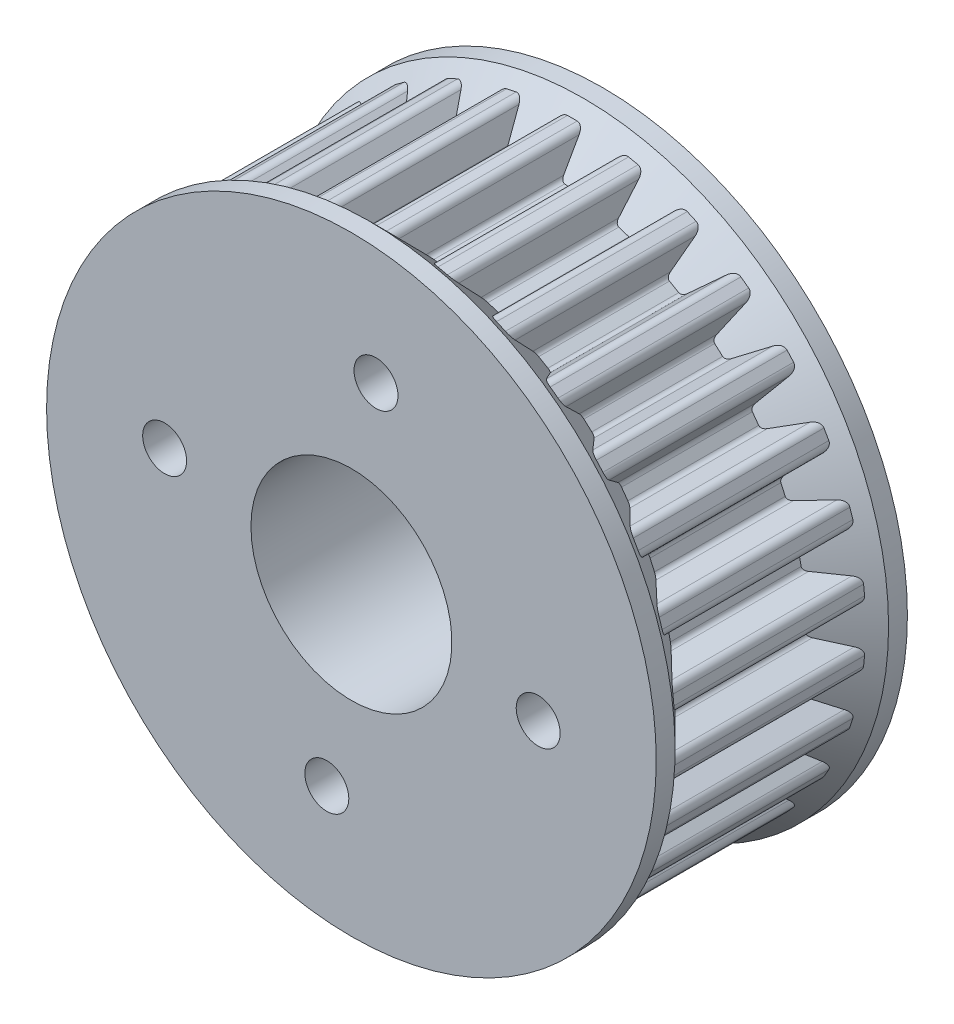
from build123d import *

# Parameters (mm, degrees)
BOSS_EXTRU_1_DEPTH      = 19
ESQUISSE2_R             = 1.75
ENL_V_MAT_EXTRU_1_DEPTH = 40.727364947
ESQUISSE4_R             = 9
ENL_V_MAT_EXTRU_2_DEPTH = 4
ESQUISSE5_R             = 8
ENL_V_MAT_EXTRU_3_DEPTH = 38.87167181
ESQUISSE6_R             = 3.75
ESQUISSE6_R_2           = 1.75
ENL_V_MAT_EXTRU_4_DEPTH = 4


with BuildPart() as part:
    # Esquisse1 → Boss.-Extru.1 (new body)
    with BuildSketch(Plane.XY):
        with BuildLine():
            Line((0.38576761, 23.359679617), (0, 23.359679617))
            Line((0, 23.359679617), (-0.38576761, 23.359679617))
            ThreePointArc((-0.38576761, 23.359679617), (-0.751024468, 23.235691621), (-0.965323106, 22.914971044))
            Line((-0.965323106, 22.914971044), (-1.42516663, 21.198811651))
            ThreePointArc((-1.42516663, 21.198811651), (-1.551757741, 20.998176883), (-1.769725575, 20.904530511))
            Line((-1.769725575, 20.904530511), (-2.615243459, 20.815663))
            ThreePointArc((-2.615243459, 20.815663), (-2.847918349, 20.861944913), (-3.013457454, 21.031875558))
            Line((-3.013457454, 21.031875558), (-3.820061895, 22.614925907))
            ThreePointArc((-3.820061895, 22.614925907), (-4.096359151, 22.884082778), (-4.479412824, 22.929420168))
            Line((-4.479412824, 22.929420168), (-4.856750486, 22.849214571))
            Line((-4.856750486, 22.849214571), (-5.234088149, 22.769008975))
            ThreePointArc((-5.234088149, 22.769008975), (-5.565584714, 22.571789244), (-5.708518855, 22.213521989))
            Line((-5.708518855, 22.213521989), (-5.801504093, 20.439257951))
            ThreePointArc((-5.801504093, 20.439257951), (-5.883614571, 20.216687762), (-6.077349109, 20.079769727))
            Line((-6.077349109, 20.079769727), (-6.885913805, 19.817051132))
            ThreePointArc((-6.885913805, 19.817051132), (-7.12312674, 19.813945844), (-7.320378987, 19.945745582))
            Line((-7.320378987, 19.945745582), (-8.43849186, 21.326499989))
            ThreePointArc((-8.43849186, 21.326499989), (-8.764712219, 21.532329707), (-9.148821423, 21.497035029))
            Line((-9.148821423, 21.497035029), (-9.501237671, 21.340129206))
            Line((-9.501237671, 21.340129206), (-9.853653919, 21.183223383))
            ThreePointArc((-9.853653919, 21.183223383), (-10.136902201, 20.921391365), (-10.202224937, 20.54123543))
            Line((-10.202224937, 20.54123543), (-9.924287989, 18.7864106))
            ThreePointArc((-9.924287989, 18.7864106), (-9.958329211, 18.551632375), (-10.119363325, 18.377426653))
            Line((-10.119363325, 18.377426653), (-10.855636675, 17.952339036))
            ThreePointArc((-10.855636675, 17.952339036), (-11.087020313, 17.899982264), (-11.307364831, 17.987890813))
            Line((-11.307364831, 17.987890813), (-12.688119239, 19.106003686))
            ThreePointArc((-12.688119239, 19.106003686), (-13.050005304, 19.239510504), (-13.418382625, 19.125126306))
            Line((-13.418382625, 19.125126306), (-13.730475177, 18.898377793))
            Line((-13.730475177, 18.898377793), (-14.04256773, 18.671629281))
            ThreePointArc((-14.04256773, 18.671629281), (-14.265188419, 18.356628291), (-14.250044834, 17.971198315))
            Line((-14.250044834, 17.971198315), (-13.613332878, 16.312506959))
            ThreePointArc((-13.613332878, 16.312506959), (-13.59781708, 16.075781634), (-13.719112806, 15.871901849))
            Line((-13.719112806, 15.871901849), (-14.350916131, 15.30302358))
            ThreePointArc((-14.350916131, 15.30302358), (-14.566357897, 15.203703565), (-14.800164573, 15.2438789))
            Line((-14.800164573, 15.2438789), (-16.383214922, 16.050483341))
            ThreePointArc((-16.383214922, 16.050483341), (-16.764950537, 16.105832371), (-17.101496117, 15.91735779))
            Line((-17.101496117, 15.91735779), (-17.359625032, 15.630676587))
            Line((-17.359625032, 15.630676587), (-17.617753947, 15.343995383))
            ThreePointArc((-17.617753947, 15.343995383), (-17.770017452, 14.989592477), (-17.675069393, 14.615733598))
            Line((-17.675069393, 14.615733598), (-16.707409796, 13.125668488))
            ThreePointArc((-16.707409796, 13.125668488), (-16.643015093, 12.897342094), (-16.719271225, 12.672698773))
            Line((-16.719271225, 12.672698773), (-17.218991689, 11.984892561))
            ThreePointArc((-17.218991689, 11.984892561), (-17.409075743, 11.842950065), (-17.646126105, 11.833636331))
            Line((-17.646126105, 11.833636331), (-19.362285498, 12.293479855))
            ThreePointArc((-19.362285498, 12.293479855), (-19.747186985, 12.268252079), (-20.037192168, 12.013924359))
            Line((-20.037192168, 12.013924359), (-20.230075973, 11.679839809))
            Line((-20.230075973, 11.679839809), (-20.422959778, 11.345755258))
            ThreePointArc((-20.422959778, 11.345755258), (-20.498211452, 10.967439543), (-20.327608604, 10.621491189))
            Line((-20.327608604, 10.621491189), (-19.071292734, 9.365175319))
            ThreePointArc((-19.071292734, 9.365175319), (-18.960833484, 9.155226817), (-18.988717264, 8.91963795))
            Line((-18.988717264, 8.91963795), (-19.334514684, 8.142964227))
            ThreePointArc((-19.334514684, 8.142964227), (-19.490933441, 7.964602819), (-19.72086725, 7.906207071))
            Line((-19.72086725, 7.906207071), (-21.495131287, 7.999192309))
            ThreePointArc((-21.495131287, 7.999192309), (-21.866376603, 7.894490301), (-22.097166771, 7.585424784))
            Line((-22.097166771, 7.585424784), (-22.216375519, 7.218537985))
            Line((-22.216375519, 7.218537985), (-22.335584266, 6.851651185))
            ThreePointArc((-22.335584266, 6.851651185), (-22.330535251, 6.465956873), (-22.091733777, 6.163038648))
            Line((-22.091733777, 6.163038648), (-20.601668667, 5.195379051))
            ThreePointArc((-20.601668667, 5.195379051), (-20.449972468, 5.012984196), (-20.42826524, 4.776746147))
            Line((-20.42826524, 4.776746147), (-20.60502661, 3.945149283))
            ThreePointArc((-20.60502661, 3.945149283), (-20.720943821, 3.738164211), (-20.933711865, 3.633238623))
            Line((-20.933711865, 3.633238623), (-22.688536694, 3.355301674))
            ThreePointArc((-22.688536694, 3.355301674), (-23.029900638, 3.175701415), (-23.191389153, 2.825405748))
            Line((-23.191389153, 2.825405748), (-23.231712848, 2.441751413))
            Line((-23.231712848, 2.441751413), (-23.272036544, 2.058097078))
            ThreePointArc((-23.272036544, 2.058097078), (-23.186907505, 1.681880861), (-22.890344176, 1.435231744))
            Line((-22.890344176, 1.435231744), (-21.23165282, 0.798519787))
            ThreePointArc((-21.23165282, 0.798519787), (-21.045349525, 0.651650111), (-20.975, 0.425087617))
            Line((-20.975, 0.425087617), (-20.975, -0.425087617))
            ThreePointArc((-20.975, -0.425087617), (-21.045349525, -0.651650111), (-21.23165282, -0.798519787))
            Line((-21.23165282, -0.798519787), (-22.890344176, -1.435231744))
            ThreePointArc((-22.890344176, -1.435231744), (-23.186907505, -1.681880861), (-23.272036544, -2.058097078))
            Line((-23.272036544, -2.058097078), (-23.231712848, -2.441751413))
            Line((-23.231712848, -2.441751413), (-23.191389153, -2.825405748))
            ThreePointArc((-23.191389153, -2.825405748), (-23.029900638, -3.175701415), (-22.688536694, -3.355301674))
            Line((-22.688536694, -3.355301674), (-20.933711865, -3.633238623))
            ThreePointArc((-20.933711865, -3.633238623), (-20.720943821, -3.738164211), (-20.60502661, -3.945149283))
            Line((-20.60502661, -3.945149283), (-20.42826524, -4.776746147))
            ThreePointArc((-20.42826524, -4.776746147), (-20.449972468, -5.012984196), (-20.601668667, -5.195379051))
            Line((-20.601668667, -5.195379051), (-22.091733777, -6.163038648))
            ThreePointArc((-22.091733777, -6.163038648), (-22.330535251, -6.465956873), (-22.335584266, -6.851651185))
            Line((-22.335584266, -6.851651185), (-22.216375519, -7.218537985))
            Line((-22.216375519, -7.218537985), (-22.097166771, -7.585424784))
            ThreePointArc((-22.097166771, -7.585424784), (-21.866376603, -7.894490301), (-21.495131287, -7.999192309))
            Line((-21.495131287, -7.999192309), (-19.72086725, -7.906207071))
            ThreePointArc((-19.72086725, -7.906207071), (-19.490933441, -7.964602819), (-19.334514684, -8.142964227))
            Line((-19.334514684, -8.142964227), (-18.988717264, -8.91963795))
            ThreePointArc((-18.988717264, -8.91963795), (-18.960833484, -9.155226817), (-19.071292734, -9.365175319))
            Line((-19.071292734, -9.365175319), (-20.327608604, -10.621491189))
            ThreePointArc((-20.327608604, -10.621491189), (-20.498211452, -10.967439543), (-20.422959778, -11.345755258))
            Line((-20.422959778, -11.345755258), (-20.230075973, -11.679839809))
            Line((-20.230075973, -11.679839809), (-20.037192168, -12.013924359))
            ThreePointArc((-20.037192168, -12.013924359), (-19.747186985, -12.268252079), (-19.362285498, -12.293479855))
            Line((-19.362285498, -12.293479855), (-17.646126105, -11.833636331))
            ThreePointArc((-17.646126105, -11.833636331), (-17.409075743, -11.842950065), (-17.218991689, -11.984892561))
            Line((-17.218991689, -11.984892561), (-16.719271225, -12.672698773))
            ThreePointArc((-16.719271225, -12.672698773), (-16.643015093, -12.897342094), (-16.707409796, -13.125668488))
            Line((-16.707409796, -13.125668488), (-17.675069393, -14.615733598))
            ThreePointArc((-17.675069393, -14.615733598), (-17.770017452, -14.989592477), (-17.617753947, -15.343995383))
            Line((-17.617753947, -15.343995383), (-17.359625032, -15.630676587))
            Line((-17.359625032, -15.630676587), (-17.101496117, -15.91735779))
            ThreePointArc((-17.101496117, -15.91735779), (-16.764950537, -16.105832371), (-16.383214922, -16.050483341))
            Line((-16.383214922, -16.050483341), (-14.800164573, -15.2438789))
            ThreePointArc((-14.800164573, -15.2438789), (-14.566357897, -15.203703565), (-14.350916131, -15.30302358))
            Line((-14.350916131, -15.30302358), (-13.719112806, -15.871901849))
            ThreePointArc((-13.719112806, -15.871901849), (-13.59781708, -16.075781634), (-13.613332878, -16.312506959))
            Line((-13.613332878, -16.312506959), (-14.250044834, -17.971198315))
            ThreePointArc((-14.250044834, -17.971198315), (-14.265188419, -18.356628291), (-14.04256773, -18.671629281))
            Line((-14.04256773, -18.671629281), (-13.730475177, -18.898377793))
            Line((-13.730475177, -18.898377793), (-13.418382625, -19.125126306))
            ThreePointArc((-13.418382625, -19.125126306), (-13.050005304, -19.239510504), (-12.688119239, -19.106003686))
            Line((-12.688119239, -19.106003686), (-11.307364831, -17.987890813))
            ThreePointArc((-11.307364831, -17.987890813), (-11.087020313, -17.899982264), (-10.855636675, -17.952339036))
            Line((-10.855636675, -17.952339036), (-10.119363325, -18.377426653))
            ThreePointArc((-10.119363325, -18.377426653), (-9.958329211, -18.551632375), (-9.924287989, -18.7864106))
            Line((-9.924287989, -18.7864106), (-10.202224937, -20.54123543))
            ThreePointArc((-10.202224937, -20.54123543), (-10.136902201, -20.921391365), (-9.853653919, -21.183223383))
            Line((-9.853653919, -21.183223383), (-9.501237671, -21.340129206))
            Line((-9.501237671, -21.340129206), (-9.148821423, -21.497035029))
            ThreePointArc((-9.148821423, -21.497035029), (-8.764712219, -21.532329707), (-8.43849186, -21.326499989))
            Line((-8.43849186, -21.326499989), (-7.320378987, -19.945745582))
            ThreePointArc((-7.320378987, -19.945745582), (-7.12312674, -19.813945844), (-6.885913805, -19.817051132))
            Line((-6.885913805, -19.817051132), (-6.077349109, -20.079769727))
            ThreePointArc((-6.077349109, -20.079769727), (-5.883614571, -20.216687762), (-5.801504093, -20.439257951))
            Line((-5.801504093, -20.439257951), (-5.708518855, -22.213521989))
            ThreePointArc((-5.708518855, -22.213521989), (-5.565584714, -22.571789244), (-5.234088149, -22.769008975))
            Line((-5.234088149, -22.769008975), (-4.856750486, -22.849214571))
            Line((-4.856750486, -22.849214571), (-4.479412824, -22.929420168))
            ThreePointArc((-4.479412824, -22.929420168), (-4.096359151, -22.884082778), (-3.820061895, -22.614925907))
            Line((-3.820061895, -22.614925907), (-3.013457454, -21.031875558))
            ThreePointArc((-3.013457454, -21.031875558), (-2.847918349, -20.861944913), (-2.615243459, -20.815663))
            Line((-2.615243459, -20.815663), (-1.769725575, -20.904530511))
            ThreePointArc((-1.769725575, -20.904530511), (-1.551757741, -20.998176883), (-1.42516663, -21.198811651))
            Line((-1.42516663, -21.198811651), (-0.965323106, -22.914971044))
            ThreePointArc((-0.965323106, -22.914971044), (-0.751024468, -23.235691621), (-0.38576761, -23.359679617))
            Line((-0.38576761, -23.359679617), (0, -23.359679617))
            Line((0, -23.359679617), (0.38576761, -23.359679617))
            ThreePointArc((0.38576761, -23.359679617), (0.751024468, -23.235691621), (0.965323106, -22.914971044))
            Line((0.965323106, -22.914971044), (1.42516663, -21.198811651))
            ThreePointArc((1.42516663, -21.198811651), (1.551757741, -20.998176883), (1.769725575, -20.904530511))
            Line((1.769725575, -20.904530511), (2.615243459, -20.815663))
            ThreePointArc((2.615243459, -20.815663), (2.847918349, -20.861944913), (3.013457454, -21.031875558))
            Line((3.013457454, -21.031875558), (3.820061895, -22.614925907))
            ThreePointArc((3.820061895, -22.614925907), (4.096359151, -22.884082778), (4.479412824, -22.929420168))
            Line((4.479412824, -22.929420168), (4.856750486, -22.849214571))
            Line((4.856750486, -22.849214571), (5.234088149, -22.769008975))
            ThreePointArc((5.234088149, -22.769008975), (5.565584714, -22.571789244), (5.708518855, -22.213521989))
            Line((5.708518855, -22.213521989), (5.801504093, -20.439257951))
            ThreePointArc((5.801504093, -20.439257951), (5.883614571, -20.216687762), (6.077349109, -20.079769727))
            Line((6.077349109, -20.079769727), (6.885913805, -19.817051132))
            ThreePointArc((6.885913805, -19.817051132), (7.12312674, -19.813945844), (7.320378987, -19.945745582))
            Line((7.320378987, -19.945745582), (8.43849186, -21.326499989))
            ThreePointArc((8.43849186, -21.326499989), (8.764712219, -21.532329707), (9.148821423, -21.497035029))
            Line((9.148821423, -21.497035029), (9.501237671, -21.340129206))
            Line((9.501237671, -21.340129206), (9.853653919, -21.183223383))
            ThreePointArc((9.853653919, -21.183223383), (10.136902201, -20.921391365), (10.202224937, -20.54123543))
            Line((10.202224937, -20.54123543), (9.924287989, -18.7864106))
            ThreePointArc((9.924287989, -18.7864106), (9.958329211, -18.551632375), (10.119363325, -18.377426653))
            Line((10.119363325, -18.377426653), (10.855636675, -17.952339036))
            ThreePointArc((10.855636675, -17.952339036), (11.087020313, -17.899982264), (11.307364831, -17.987890813))
            Line((11.307364831, -17.987890813), (12.688119239, -19.106003686))
            ThreePointArc((12.688119239, -19.106003686), (13.050005304, -19.239510504), (13.418382625, -19.125126306))
            Line((13.418382625, -19.125126306), (13.730475177, -18.898377793))
            Line((13.730475177, -18.898377793), (14.04256773, -18.671629281))
            ThreePointArc((14.04256773, -18.671629281), (14.265188419, -18.356628291), (14.250044834, -17.971198315))
            Line((14.250044834, -17.971198315), (13.613332878, -16.312506959))
            ThreePointArc((13.613332878, -16.312506959), (13.59781708, -16.075781634), (13.719112806, -15.871901849))
            Line((13.719112806, -15.871901849), (14.350916131, -15.30302358))
            ThreePointArc((14.350916131, -15.30302358), (14.566357897, -15.203703565), (14.800164573, -15.2438789))
            Line((14.800164573, -15.2438789), (16.383214922, -16.050483341))
            ThreePointArc((16.383214922, -16.050483341), (16.764950537, -16.105832371), (17.101496117, -15.91735779))
            Line((17.101496117, -15.91735779), (17.359625032, -15.630676587))
            Line((17.359625032, -15.630676587), (17.617753947, -15.343995383))
            ThreePointArc((17.617753947, -15.343995383), (17.770017452, -14.989592477), (17.675069393, -14.615733598))
            Line((17.675069393, -14.615733598), (16.707409796, -13.125668488))
            ThreePointArc((16.707409796, -13.125668488), (16.643015093, -12.897342094), (16.719271225, -12.672698773))
            Line((16.719271225, -12.672698773), (17.218991689, -11.984892561))
            ThreePointArc((17.218991689, -11.984892561), (17.409075743, -11.842950065), (17.646126105, -11.833636331))
            Line((17.646126105, -11.833636331), (19.362285498, -12.293479855))
            ThreePointArc((19.362285498, -12.293479855), (19.747186985, -12.268252079), (20.037192168, -12.013924359))
            Line((20.037192168, -12.013924359), (20.230075973, -11.679839809))
            Line((20.230075973, -11.679839809), (20.422959778, -11.345755258))
            ThreePointArc((20.422959778, -11.345755258), (20.498211452, -10.967439543), (20.327608604, -10.621491189))
            Line((20.327608604, -10.621491189), (19.071292734, -9.365175319))
            ThreePointArc((19.071292734, -9.365175319), (18.960833484, -9.155226817), (18.988717264, -8.91963795))
            Line((18.988717264, -8.91963795), (19.334514684, -8.142964227))
            ThreePointArc((19.334514684, -8.142964227), (19.490933441, -7.964602819), (19.72086725, -7.906207071))
            Line((19.72086725, -7.906207071), (21.495131287, -7.999192309))
            ThreePointArc((21.495131287, -7.999192309), (21.866376603, -7.894490301), (22.097166771, -7.585424784))
            Line((22.097166771, -7.585424784), (22.216375519, -7.218537985))
            Line((22.216375519, -7.218537985), (22.335584266, -6.851651185))
            ThreePointArc((22.335584266, -6.851651185), (22.330535251, -6.465956873), (22.091733777, -6.163038648))
            Line((22.091733777, -6.163038648), (20.601668667, -5.195379051))
            ThreePointArc((20.601668667, -5.195379051), (20.449972468, -5.012984196), (20.42826524, -4.776746147))
            Line((20.42826524, -4.776746147), (20.60502661, -3.945149283))
            ThreePointArc((20.60502661, -3.945149283), (20.720943821, -3.738164211), (20.933711865, -3.633238623))
            Line((20.933711865, -3.633238623), (22.688536694, -3.355301674))
            ThreePointArc((22.688536694, -3.355301674), (23.029900638, -3.175701415), (23.191389153, -2.825405748))
            Line((23.191389153, -2.825405748), (23.231712848, -2.441751413))
            Line((23.231712848, -2.441751413), (23.272036544, -2.058097078))
            ThreePointArc((23.272036544, -2.058097078), (23.186907505, -1.681880861), (22.890344176, -1.435231744))
            Line((22.890344176, -1.435231744), (21.23165282, -0.798519787))
            ThreePointArc((21.23165282, -0.798519787), (21.045349525, -0.651650111), (20.975, -0.425087617))
            Line((20.975, -0.425087617), (20.975, 0.425087617))
            ThreePointArc((20.975, 0.425087617), (21.045349525, 0.651650111), (21.23165282, 0.798519787))
            Line((21.23165282, 0.798519787), (22.890344176, 1.435231744))
            ThreePointArc((22.890344176, 1.435231744), (23.186907505, 1.681880861), (23.272036544, 2.058097078))
            Line((23.272036544, 2.058097078), (23.231712848, 2.441751413))
            Line((23.231712848, 2.441751413), (23.191389153, 2.825405748))
            ThreePointArc((23.191389153, 2.825405748), (23.029900638, 3.175701415), (22.688536694, 3.355301674))
            Line((22.688536694, 3.355301674), (20.933711865, 3.633238623))
            ThreePointArc((20.933711865, 3.633238623), (20.720943821, 3.738164211), (20.60502661, 3.945149283))
            Line((20.60502661, 3.945149283), (20.42826524, 4.776746147))
            ThreePointArc((20.42826524, 4.776746147), (20.449972468, 5.012984196), (20.601668667, 5.195379051))
            Line((20.601668667, 5.195379051), (22.091733777, 6.163038648))
            ThreePointArc((22.091733777, 6.163038648), (22.330535251, 6.465956873), (22.335584266, 6.851651185))
            Line((22.335584266, 6.851651185), (22.216375519, 7.218537985))
            Line((22.216375519, 7.218537985), (22.097166771, 7.585424784))
            ThreePointArc((22.097166771, 7.585424784), (21.866376603, 7.894490301), (21.495131287, 7.999192309))
            Line((21.495131287, 7.999192309), (19.72086725, 7.906207071))
            ThreePointArc((19.72086725, 7.906207071), (19.490933441, 7.964602819), (19.334514684, 8.142964227))
            Line((19.334514684, 8.142964227), (18.988717264, 8.91963795))
            ThreePointArc((18.988717264, 8.91963795), (18.960833484, 9.155226817), (19.071292734, 9.365175319))
            Line((19.071292734, 9.365175319), (20.327608604, 10.621491189))
            ThreePointArc((20.327608604, 10.621491189), (20.498211452, 10.967439543), (20.422959778, 11.345755258))
            Line((20.422959778, 11.345755258), (20.230075973, 11.679839809))
            Line((20.230075973, 11.679839809), (20.037192168, 12.013924359))
            ThreePointArc((20.037192168, 12.013924359), (19.747186985, 12.268252079), (19.362285498, 12.293479855))
            Line((19.362285498, 12.293479855), (17.646126105, 11.833636331))
            ThreePointArc((17.646126105, 11.833636331), (17.409075743, 11.842950065), (17.218991689, 11.984892561))
            Line((17.218991689, 11.984892561), (16.719271225, 12.672698773))
            ThreePointArc((16.719271225, 12.672698773), (16.643015093, 12.897342094), (16.707409796, 13.125668488))
            Line((16.707409796, 13.125668488), (17.675069393, 14.615733598))
            ThreePointArc((17.675069393, 14.615733598), (17.770017452, 14.989592477), (17.617753947, 15.343995383))
            Line((17.617753947, 15.343995383), (17.359625032, 15.630676587))
            Line((17.359625032, 15.630676587), (17.101496117, 15.91735779))
            ThreePointArc((17.101496117, 15.91735779), (16.764950537, 16.105832371), (16.383214922, 16.050483341))
            Line((16.383214922, 16.050483341), (14.800164573, 15.2438789))
            ThreePointArc((14.800164573, 15.2438789), (14.566357897, 15.203703565), (14.350916131, 15.30302358))
            Line((14.350916131, 15.30302358), (13.719112806, 15.871901849))
            ThreePointArc((13.719112806, 15.871901849), (13.59781708, 16.075781634), (13.613332878, 16.312506959))
            Line((13.613332878, 16.312506959), (14.250044834, 17.971198315))
            ThreePointArc((14.250044834, 17.971198315), (14.265188419, 18.356628291), (14.04256773, 18.671629281))
            Line((14.04256773, 18.671629281), (13.730475177, 18.898377793))
            Line((13.730475177, 18.898377793), (13.418382625, 19.125126306))
            ThreePointArc((13.418382625, 19.125126306), (13.050005304, 19.239510504), (12.688119239, 19.106003686))
            Line((12.688119239, 19.106003686), (11.307364831, 17.987890813))
            ThreePointArc((11.307364831, 17.987890813), (11.087020313, 17.899982264), (10.855636675, 17.952339036))
            Line((10.855636675, 17.952339036), (10.119363325, 18.377426653))
            ThreePointArc((10.119363325, 18.377426653), (9.958329211, 18.551632375), (9.924287989, 18.7864106))
            Line((9.924287989, 18.7864106), (10.202224937, 20.54123543))
            ThreePointArc((10.202224937, 20.54123543), (10.136902201, 20.921391365), (9.853653919, 21.183223383))
            Line((9.853653919, 21.183223383), (9.501237671, 21.340129206))
            Line((9.501237671, 21.340129206), (9.148821423, 21.497035029))
            ThreePointArc((9.148821423, 21.497035029), (8.764712219, 21.532329707), (8.43849186, 21.326499989))
            Line((8.43849186, 21.326499989), (7.320378987, 19.945745582))
            ThreePointArc((7.320378987, 19.945745582), (7.12312674, 19.813945844), (6.885913805, 19.817051132))
            Line((6.885913805, 19.817051132), (6.077349109, 20.079769727))
            ThreePointArc((6.077349109, 20.079769727), (5.883614571, 20.216687762), (5.801504093, 20.439257951))
            Line((5.801504093, 20.439257951), (5.708518855, 22.213521989))
            ThreePointArc((5.708518855, 22.213521989), (5.565584714, 22.571789244), (5.234088149, 22.769008975))
            Line((5.234088149, 22.769008975), (4.856750486, 22.849214571))
            Line((4.856750486, 22.849214571), (4.479412824, 22.929420168))
            ThreePointArc((4.479412824, 22.929420168), (4.096359151, 22.884082778), (3.820061895, 22.614925907))
            Line((3.820061895, 22.614925907), (3.013457454, 21.031875558))
            ThreePointArc((3.013457454, 21.031875558), (2.847918349, 20.861944913), (2.615243459, 20.815663))
            Line((2.615243459, 20.815663), (1.769725575, 20.904530511))
            ThreePointArc((1.769725575, 20.904530511), (1.551757741, 20.998176883), (1.42516663, 21.198811651))
            Line((1.42516663, 21.198811651), (0.965323106, 22.914971044))
            ThreePointArc((0.965323106, 22.914971044), (0.751024468, 23.235691621), (0.38576761, 23.359679617))
        make_face()
    extrude(amount=BOSS_EXTRU_1_DEPTH)

    # Esquisse3 → Révolution1 (revolve)
    with BuildSketch(Plane(origin=(0, 0, 0), x_dir=(1, 0, 0), z_dir=(0, 1, 0))):
        Polygon((-20.772036544, -4.5), (-20.772036544, -14.5), (-24.272036544, -18), (-24.272036544, -19.5), (-8, -19.5), (-8, 0.5), (-24.272036544, 0.5), (-24.272036544, -1), align=None)
    revolve(axis=Axis((0, 0, 0), (0, 0, 1)))

    # Esquisse2 → Enlèv. mat.-Extru.1 (cut, through all)
    with BuildSketch(Plane.XY.offset(-0.5)):
        with Locations((14.871672921, -1.957892883)):
            Circle(ESQUISSE2_R)
        with Locations((1.957892883, 14.871672921)):
            Circle(ESQUISSE2_R)
        with Locations((-1.957892883, -14.871672921)):
            Circle(ESQUISSE2_R)
        with Locations((-14.871672921, 1.957892883)):
            Circle(ESQUISSE2_R)
    extrude(amount=ENL_V_MAT_EXTRU_1_DEPTH, mode=Mode.SUBTRACT)

    # Esquisse4 → Enlèv. mat.-Extru.2 (cut)
    with BuildSketch(Plane(origin=(0, 0, -0.5), x_dir=(-1, 0, 0), z_dir=(0, 0, -1))):
        Circle(ESQUISSE4_R)
    extrude(amount=-ENL_V_MAT_EXTRU_2_DEPTH, mode=Mode.SUBTRACT)

    # Esquisse5 → Enlèv. mat.-Extru.3 (cut, through all)
    with BuildSketch(Plane(origin=(0, 0, 3.5), x_dir=(-1, 0, 0), z_dir=(0, 0, -1))):
        Circle(ESQUISSE5_R)
    extrude(amount=-ENL_V_MAT_EXTRU_3_DEPTH, mode=Mode.SUBTRACT)

    # Esquisse6 → Enlèv. mat.-Extru.4 (cut)
    # profile 1 of 4: a face of its own
    with BuildSketch(Plane(origin=(0, 0, -0.5), x_dir=(-1, 0, 0), z_dir=(0, 0, -1))):
        with Locations((-1.957892883, 14.871672921)):
            Circle(ESQUISSE6_R)
        with Locations((-1.957892883, 14.871672921)):
            Circle(ESQUISSE6_R_2, mode=Mode.SUBTRACT)
    # profile 2 of 4: a face of its own
    with BuildSketch(Plane(origin=(0, 0, -0.5), x_dir=(-1, 0, 0), z_dir=(0, 0, -1))):
        with Locations((-14.871672921, -1.957892883)):
            Circle(ESQUISSE6_R)
        with Locations((-14.871672921, -1.957892883)):
            Circle(ESQUISSE6_R_2, mode=Mode.SUBTRACT)
    # profile 3 of 4: a face of its own
    with BuildSketch(Plane(origin=(0, 0, -0.5), x_dir=(-1, 0, 0), z_dir=(0, 0, -1))):
        with Locations((1.957892883, -14.871672921)):
            Circle(ESQUISSE6_R)
        with Locations((1.957892883, -14.871672921)):
            Circle(ESQUISSE6_R_2, mode=Mode.SUBTRACT)
    # profile 4 of 4: a face of its own
    with BuildSketch(Plane(origin=(0, 0, -0.5), x_dir=(-1, 0, 0), z_dir=(0, 0, -1))):
        with Locations((14.871672921, 1.957892883)):
            Circle(ESQUISSE6_R)
        with Locations((14.871672921, 1.957892883)):
            Circle(ESQUISSE6_R_2, mode=Mode.SUBTRACT)
    extrude(amount=-ENL_V_MAT_EXTRU_4_DEPTH, mode=Mode.SUBTRACT)


solid = part.part
